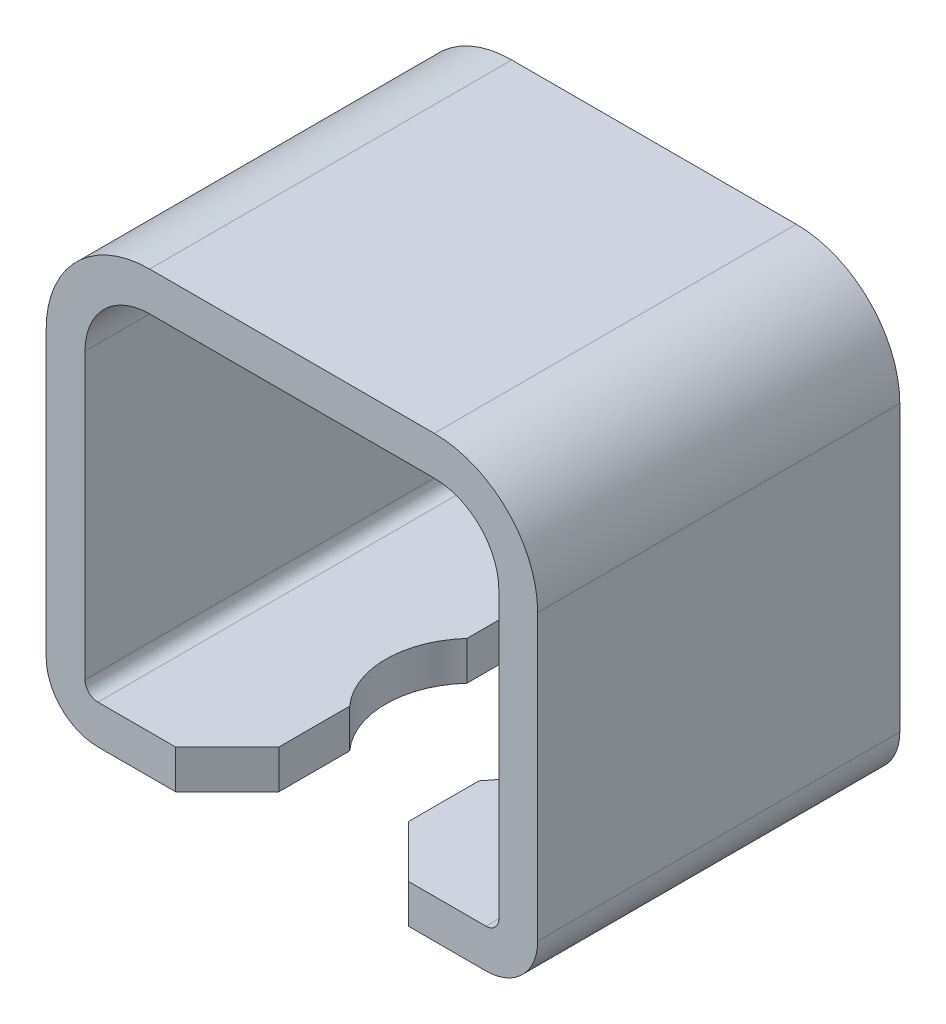
from build123d import *

# Parameters (mm, degrees)
EXTRUDE_THIN1_DEPTH = 7
CUT_EXTRUDE2_REACH  = 22.694
CHAMFER1_SIZE       = 2


with BuildPart() as part:
    # Sketch1 → Extrude-Thin1 (new, symmetric)
    with BuildSketch(Plane.XY):
        with BuildLine():
            Line((7.5, -8.5), (-7.5, -8.5))
            ThreePointArc((-7.5, -8.5), (-8.914213562, -7.914213562), (-9.5, -6.5))
            Line((-9.5, -6.5), (-9.5, 4.5))
            ThreePointArc((-9.5, 4.5), (-8.328427125, 7.328427125), (-5.5, 8.5))
            Line((-5.5, 8.5), (5.5, 8.5))
            ThreePointArc((5.5, 8.5), (8.328427125, 7.328427125), (9.5, 4.5))
            Line((9.5, 4.5), (9.5, -6.5))
            ThreePointArc((9.5, -6.5), (8.914213562, -7.914213562), (7.5, -8.5))
        make_face()
        with BuildLine():
            Line((7.5, -7), (-7.5, -7))
            ThreePointArc((-7.5, -7), (-7.853553391, -6.853553391), (-8, -6.5))
            Line((-8, -6.5), (-8, 4.5))
            ThreePointArc((-8, 4.5), (-7.267766953, 6.267766953), (-5.5, 7))
            Line((-5.5, 7), (5.5, 7))
            ThreePointArc((5.5, 7), (7.267766953, 6.267766953), (8, 4.5))
            Line((8, 4.5), (8, -6.5))
            ThreePointArc((8, -6.5), (7.853553391, -6.853553391), (7.5, -7))
        make_face(mode=Mode.SUBTRACT)
    extrude(amount=EXTRUDE_THIN1_DEPTH, both=True)

    # Sketch3 → Cut-Extrude2 (cut, up to next)
    with BuildSketch(Plane.XZ.offset(8.5), mode=Mode.PRIVATE) as cut_extrude2_sk1:
        with BuildLine():
            Line((2.5, 7), (-2.5, 7))
            Line((-2.5, 7), (-2.5, 2.267294643))
            ThreePointArc((-2.5, 2.267294643), (-3.375, 0), (-2.5, -2.267294643))
            Line((-2.5, -2.267294643), (-2.5, -7))
            Line((-2.5, -7), (2.5, -7))
            Line((2.5, -7), (2.5, -2.267294643))
            ThreePointArc((2.5, -2.267294643), (3.375, 0), (2.5, 2.267294643))
            Line((2.5, 2.267294643), (2.5, 7))
        make_face()
    cut_extrude2_tool1 = extrude(cut_extrude2_sk1.sketch, amount=-CUT_EXTRUDE2_REACH, mode=Mode.PRIVATE) & part.part
    add(cut_extrude2_tool1.solids().sort_by_distance((0, -8.5, 0))[0], mode=Mode.SUBTRACT)

    # Chamfer1
    chamfer1_edges = [part.edges().sort_by_distance(p)[0] for p in [
        (-2.5, -7.75, -7),
        (2.5, -7.75, -7),
        (-2.5, -7.75, 7),
        (2.5, -7.75, 7),
    ]]
    chamfer(chamfer1_edges, length=CHAMFER1_SIZE)


solid = part.part
